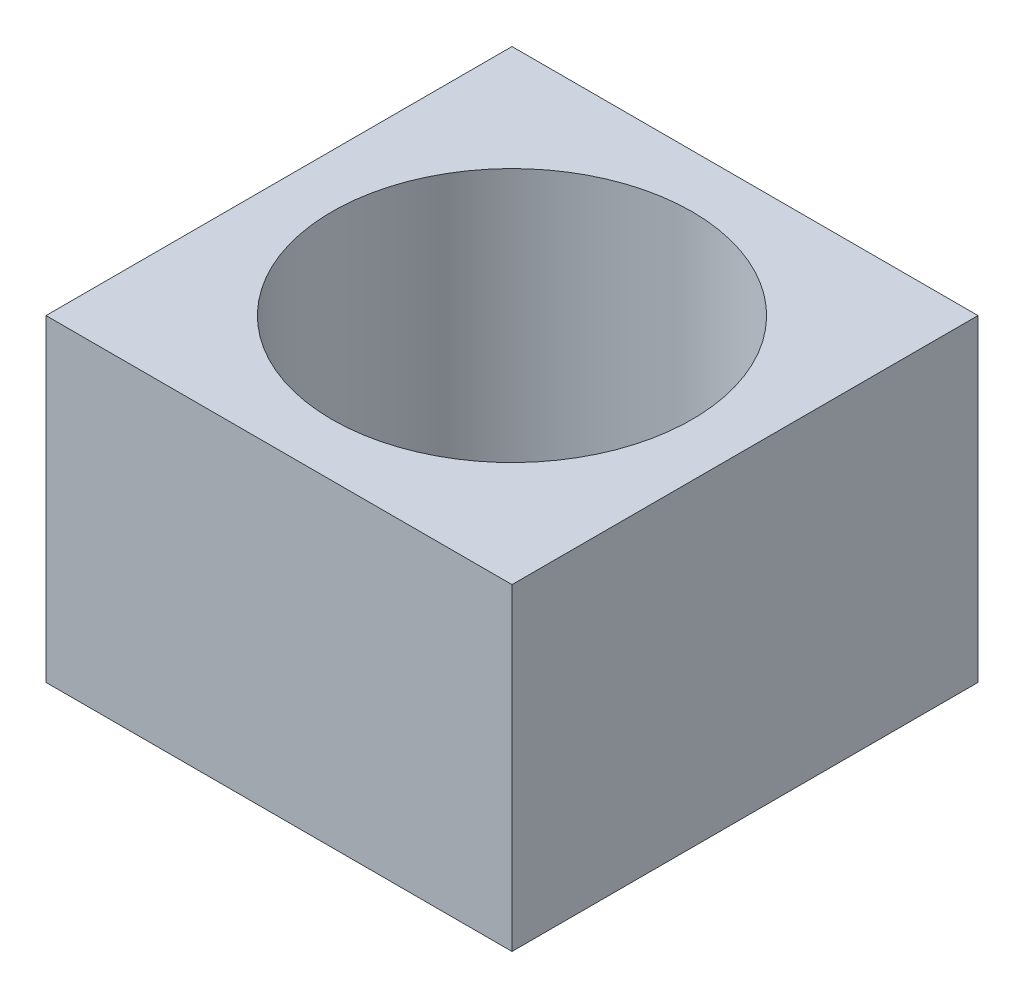
from build123d import *

# Parameters (mm, degrees)
SKETCH_1_W          = 44
SKETCH_1_H          = 44
EXTRUDE_1_DEPTH     = 30
SKETCH_2_R          = 17
CUT_EXTRUDE_1_DEPTH = 30


with BuildPart() as part:
    # 草图1 → 凸台-拉伸1 (new body)
    with BuildSketch(Plane(origin=(0, 0, 0), x_dir=(1, 0, 0), z_dir=(0, 1, 0))):
        Rectangle(SKETCH_1_W, SKETCH_1_H)
    extrude(amount=EXTRUDE_1_DEPTH)

    # 草图2 → 切除-拉伸1 (cut)
    with BuildSketch(Plane(origin=(0, 0, 0), x_dir=(1, 0, 0), z_dir=(0, 1, 0))):
        Circle(SKETCH_2_R)
    extrude(amount=CUT_EXTRUDE_1_DEPTH, mode=Mode.SUBTRACT)


solid = part.part
